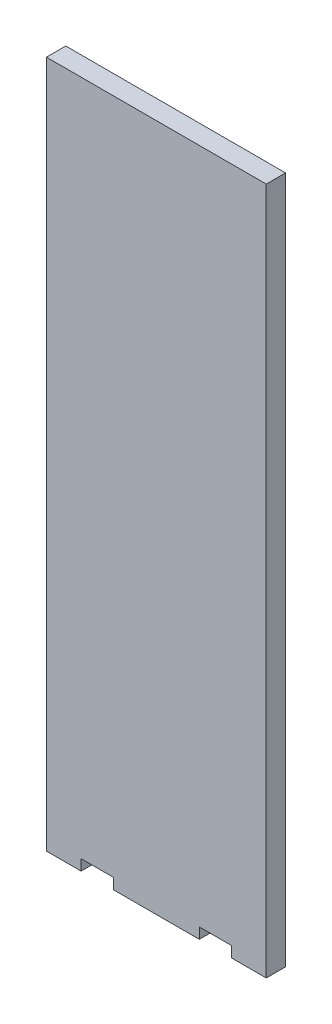
from build123d import *

# Parameters (mm, degrees)
SKETCH1_W                    = 204.6
SKETCH1_H                    = 640
BOSS_EXTRUDE1_DEPTH          = 18
SKETCH4_W                    = 30
SKETCH4_H                    = 10
CUT_EXTRUDE1_DEPTH           = 18
F_3_0_3_DIAMETER_HOLE3_D     = 3
F_3_0_3_DIAMETER_HOLE3_DEPTH = 5
F_3_0_3_DIAMETER_HOLE3_TIP   = 0.901290929


with BuildPart() as part:
    # Sketch1 → Boss-Extrude1 (new body)
    with BuildSketch(Plane.XY):
        with Locations((97, 283.5)):
            Rectangle(SKETCH1_W, SKETCH1_H)
    extrude(amount=BOSS_EXTRUDE1_DEPTH)

    # Sketch4 → Cut-Extrude1 (cut)
    with BuildSketch(Plane(origin=(0, 0, 0), x_dir=(-1, 0, 0), z_dir=(0, 0, -1))):
        with Locations((-42, -31.5)):
            Rectangle(SKETCH4_W, SKETCH4_H)
        with Locations((-152, -31.5)):
            Rectangle(SKETCH4_W, SKETCH4_H)
    extrude(amount=-CUT_EXTRUDE1_DEPTH, mode=Mode.SUBTRACT)

    # Ø3.0 (3) Diameter Hole3
    with Locations(Plane(origin=(0, 0, 0), x_dir=(-1, 0, 0), z_dir=(0, 0, -1))):
        with Locations((-183.15, 598.5), (-2.2, -1.5), (-191.8, -1.5), (-191.8, 190.5), (-191.8, 478.5), (-2.2, 478.5), (-2.2, 190.5), (-10.85, -31.5), (-97, -31.5), (-183.15, -31.5), (-10.85, 598.5), (-97, 598.5)):
            Hole(F_3_0_3_DIAMETER_HOLE3_D / 2, depth=F_3_0_3_DIAMETER_HOLE3_DEPTH)
            with Locations((0, 0, -(F_3_0_3_DIAMETER_HOLE3_DEPTH + F_3_0_3_DIAMETER_HOLE3_TIP / 2))):  # 118° drill point
                Cone(0, F_3_0_3_DIAMETER_HOLE3_D / 2, F_3_0_3_DIAMETER_HOLE3_TIP, mode=Mode.SUBTRACT)


solid = part.part
